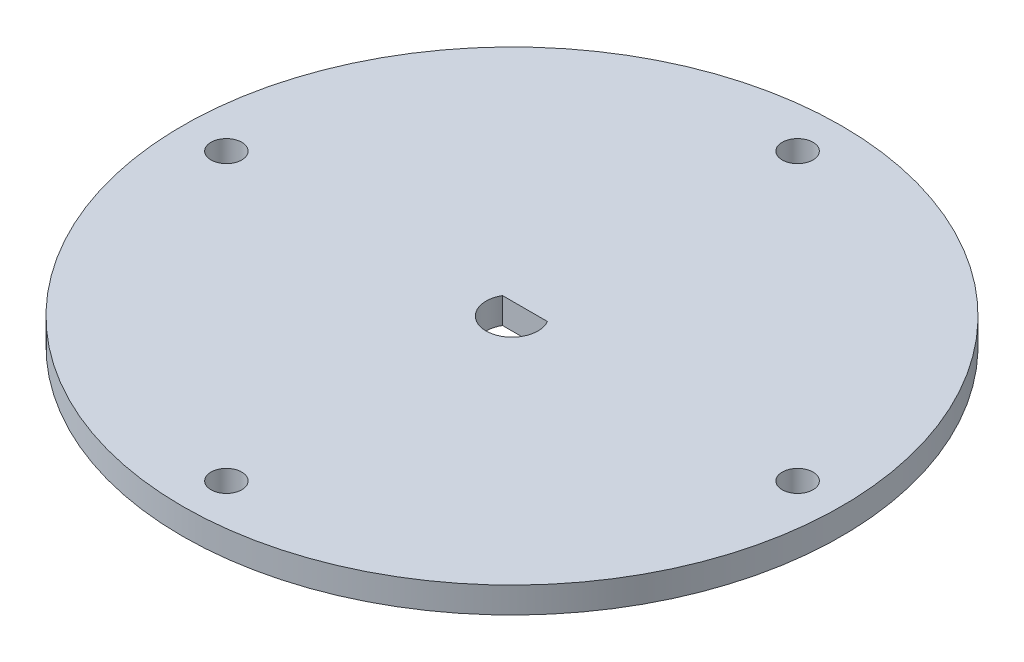
from build123d import *

# Parameters (mm, degrees)
SKETCH1_R           = 38.1
BOSS_EXTRUDE1_DEPTH = 3
SKETCH3_R           = 1.778
CUT_EXTRUDE1_DEPTH  = 54.96498865
CIRPATTERN1_COUNT   = 4
CUT_EXTRUDE2_DEPTH  = 54.96498865


with BuildPart() as part:
    # Sketch1 → Boss-Extrude1 (new body)
    with BuildSketch(Plane(origin=(0, 0, 0), x_dir=(1, 0, 0), z_dir=(0, 1, 0))):
        Circle(SKETCH1_R)
    extrude(amount=BOSS_EXTRUDE1_DEPTH)

    # Sketch3 → Cut-Extrude1 (cut, through all)
    with BuildSketch(Plane(origin=(0, 3, 0), x_dir=(1, 0, 0), z_dir=(0, 1, 0))):
        with Locations((33.02, 0)):
            Circle(SKETCH3_R)
    cut_extrude1 = extrude(amount=-CUT_EXTRUDE1_DEPTH, mode=Mode.SUBTRACT)

    # CirPattern1: Cut-Extrude1 ×4 about axis
    cirpattern1_axis = Axis((0, 3, 0), (0, -1, 0))
    for i in range(1, CIRPATTERN1_COUNT):
        add(cut_extrude1.rotate(cirpattern1_axis, i * 360 / CIRPATTERN1_COUNT), mode=Mode.SUBTRACT)

    # Sketch4 → Cut-Extrude2 (cut, through all)
    with BuildSketch(Plane(origin=(0, 3, 0), x_dir=(1, 0, 0), z_dir=(0, 1, 0))):
        with BuildLine():
            Line((-2.598076211, 1.5), (2.598076211, 1.5))
            ThreePointArc((2.598076211, 1.5), (0, -3), (-2.598076211, 1.5))
        make_face()
    extrude(amount=-CUT_EXTRUDE2_DEPTH, mode=Mode.SUBTRACT)


solid = part.part
